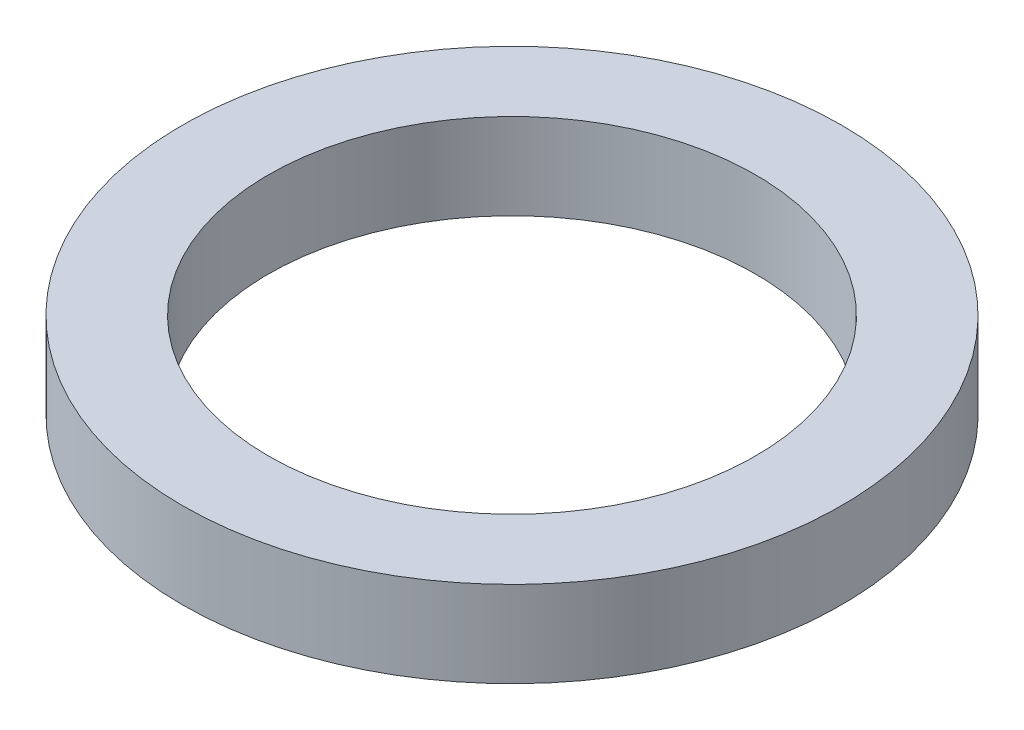
from build123d import *

# Parameters (mm, degrees)
SKETCH1_R           = 57.5
BOSS_EXTRUDE1_DEPTH = 15
SKETCH2_R           = 42.5
CUT_EXTRUDE1_DEPTH  = 83.689177043


with BuildPart() as part:
    # Sketch1 → Boss-Extrude1 (new body)
    with BuildSketch(Plane(origin=(0, 0, 0), x_dir=(1, 0, 0), z_dir=(0, 1, 0))):
        Circle(SKETCH1_R)
    extrude(amount=BOSS_EXTRUDE1_DEPTH)

    # Sketch2 → Cut-Extrude1 (cut, through all)
    with BuildSketch(Plane(origin=(0, 0, 0), x_dir=(1, 0, 0), z_dir=(0, 1, 0))):
        Circle(SKETCH2_R)
    extrude(amount=CUT_EXTRUDE1_DEPTH, mode=Mode.SUBTRACT)


solid = part.part
